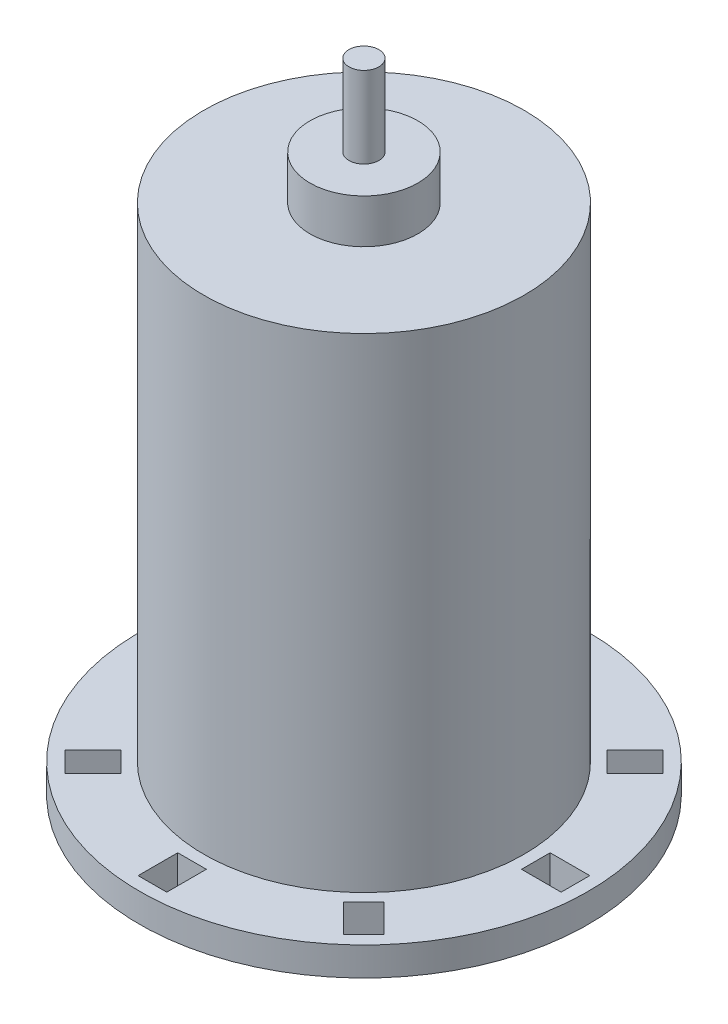
from build123d import *

# Parameters (mm, degrees)
SKICA1_R                 = 16.78
P_IDAT_VYSUNUT_M1_DEPTH  = 50.7
SKICA2_R                 = 5.65
P_IDAT_VYSUNUT_M2_DEPTH  = 4.61
SKICA3_R                 = 1.565
P_IDAT_VYSUNUT_M3_DEPTH  = 8.5
SKETCH6_R                = 23.5
BOSS_EXTRUDE1_DEPTH      = 3
SKETCH8_W                = 4.15
SKETCH8_H                = 3
SKETCH8_W_2              = 3
SKETCH8_H_2              = 4.15
ODEBRAT_VYSUNUT_M2_DEPTH = 3


with BuildPart() as part:
    # Skica1 → Přidat vysunutím1 (new body)
    with BuildSketch(Plane(origin=(0, 0, 0), x_dir=(1, 0, 0), z_dir=(0, 1, 0))):
        Circle(SKICA1_R)
    extrude(amount=P_IDAT_VYSUNUT_M1_DEPTH)

    # Skica2 → Přidat vysunutím2 (add)
    with BuildSketch(Plane(origin=(0, 50.7, 0), x_dir=(1, 0, 0), z_dir=(0, 1, 0))):
        Circle(SKICA2_R)
    extrude(amount=P_IDAT_VYSUNUT_M2_DEPTH)

    # Skica3 → Přidat vysunutím3 (add)
    with BuildSketch(Plane(origin=(0, 55.31, 0), x_dir=(1, 0, 0), z_dir=(0, 1, 0))):
        Circle(SKICA3_R)
    extrude(amount=P_IDAT_VYSUNUT_M3_DEPTH)

    # Sketch6 → Boss-Extrude1 (add)
    with BuildSketch(Plane.XZ):
        Circle(SKETCH6_R)
    extrude(amount=BOSS_EXTRUDE1_DEPTH)

    # Sketch8 → Odebrat vysunutím2 (cut)
    with BuildSketch(Plane(origin=(0, 0, 0), x_dir=(1, 0, 0), z_dir=(0, 1, 0))):
        with Locations((20.075, 0)):
            Rectangle(SKETCH8_W, SKETCH8_H)
        Polygon((11.66726189, -13.788582233), (14.601755032, -16.723075375), (16.723075375, -14.601755032), (13.788582233, -11.66726189), align=None)
        with Locations((0, -20.075)):
            Rectangle(SKETCH8_W_2, SKETCH8_H_2)
        Polygon((-13.788582233, -11.66726189), (-16.723075375, -14.601755032), (-14.601755032, -16.723075375), (-11.66726189, -13.788582233), align=None)
        with Locations((-20.075, 0)):
            Rectangle(SKETCH8_W, SKETCH8_H)
        Polygon((-11.66726189, 13.788582233), (-14.601755032, 16.723075375), (-16.723075375, 14.601755032), (-13.788582233, 11.66726189), align=None)
        with Locations((0, 20.075)):
            Rectangle(SKETCH8_W_2, SKETCH8_H_2)
        Polygon((13.788582233, 11.66726189), (16.723075375, 14.601755032), (14.601755032, 16.723075375), (11.66726189, 13.788582233), align=None)
        Polygon((6.151828996, -8.27314934), (9.086322138, -11.207642482), (11.207642482, -9.086322138), (8.27314934, -6.151828996), align=None)
        Polygon((-8.27314934, -6.151828996), (-11.207642482, -9.086322138), (-9.086322138, -11.207642482), (-6.151828996, -8.27314934), align=None)
        Polygon((-6.151828996, 8.27314934), (-9.086322138, 11.207642482), (-11.207642482, 9.086322138), (-8.27314934, 6.151828996), align=None)
        Polygon((8.27314934, 6.151828996), (11.207642482, 9.086322138), (9.086322138, 11.207642482), (6.151828996, 8.27314934), align=None)
    extrude(amount=-ODEBRAT_VYSUNUT_M2_DEPTH, mode=Mode.SUBTRACT)


solid = part.part
